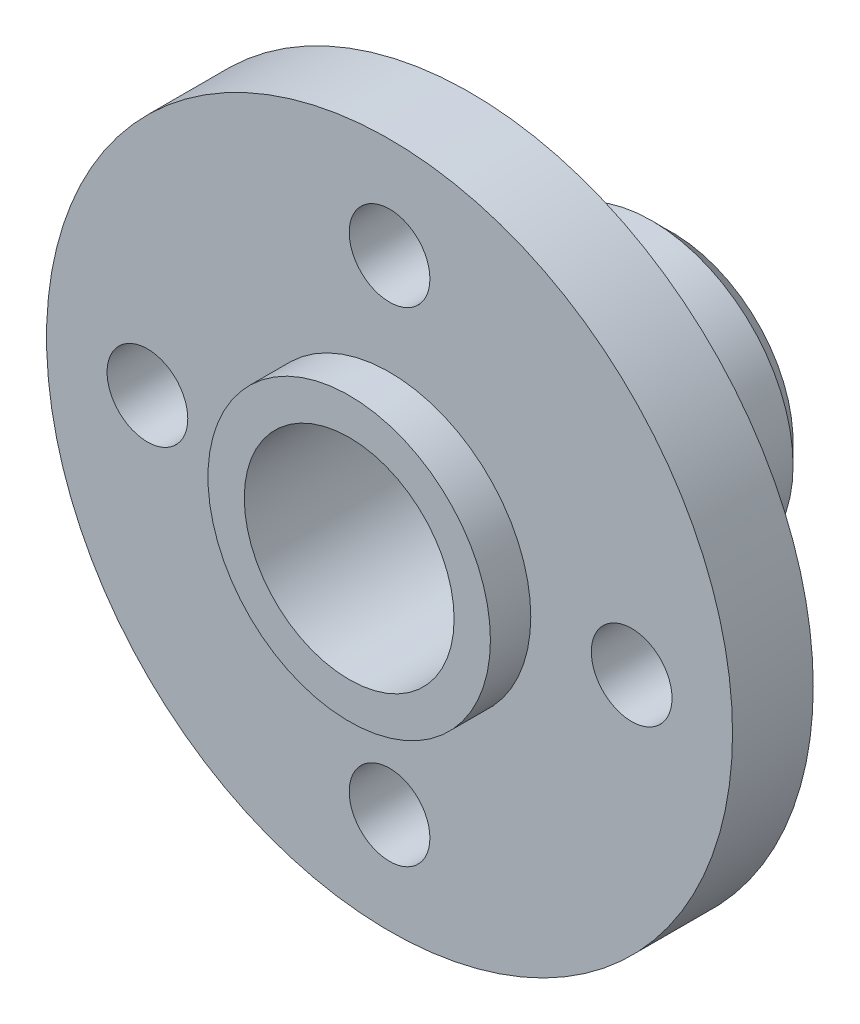
from build123d import *

# Parameters (mm, degrees)
SKETCH_2_R      = 8.5
SKETCH_2_R_2    = 2.6
SKETCH_2_R_3    = 1
EXTRUDE_1_DEPTH = 2
SKETCH_3_R      = 3.5
SKETCH_3_R_2    = 2.6
EXTRUDE_2_DEPTH = 1
EXTRUDE_START   = 5
SKETCH_4_R      = 3.5
SKETCH_4_R_2    = 2.6
EXTRUDE_3_DEPTH = 5
CHAMFER_1_SIZE  = 0.5


with BuildPart() as part:
    # Эскиз2 → Бобышка-Вытянуть1 (new body)
    with BuildSketch(Plane.XY):
        Circle(SKETCH_2_R)
        Circle(SKETCH_2_R_2, mode=Mode.SUBTRACT)
        with Locations((-6, 0)):
            Circle(SKETCH_2_R_3, mode=Mode.SUBTRACT)
        with Locations((0, 6)):
            Circle(SKETCH_2_R_3, mode=Mode.SUBTRACT)
        with Locations((6, 0)):
            Circle(SKETCH_2_R_3, mode=Mode.SUBTRACT)
        with Locations((0, -6)):
            Circle(SKETCH_2_R_3, mode=Mode.SUBTRACT)
    extrude(amount=EXTRUDE_1_DEPTH)

    # Эскиз3 → Бобышка-Вытянуть2 (add)
    with BuildSketch(Plane.XY.offset(2)):
        Circle(SKETCH_3_R)
        Circle(SKETCH_3_R_2, mode=Mode.SUBTRACT)
    extrude(amount=EXTRUDE_2_DEPTH)

    # Эскиз4 → Бобышка-Вытянуть3 (add)
    with BuildSketch(Plane(origin=(0, 0, 0), x_dir=(-1, 0, 0), z_dir=(0, 0, -1)).offset(EXTRUDE_START)):
        Circle(SKETCH_4_R)
        Circle(SKETCH_4_R_2, mode=Mode.SUBTRACT)
    extrude(amount=-EXTRUDE_3_DEPTH)

    # Фаска1
    chamfer_1_edges = [part.edges().sort_by_distance(p)[0] for p in [
        (3.5, 0, -5),
    ]]
    chamfer(chamfer_1_edges, length=CHAMFER_1_SIZE)


solid = part.part
